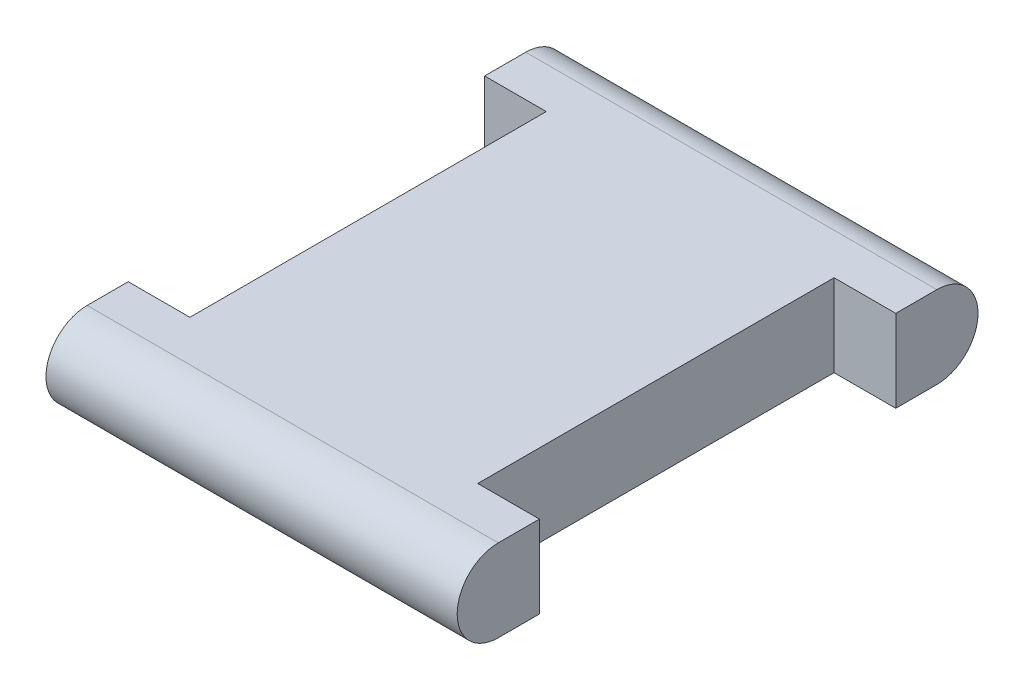
from build123d import *

# Parameters (mm, degrees)
AUFSATZ_LINEAR_AUSTRAGEN1_DEPTH = 75
SKIZZE5_OUTSIDE_W               = 200.786
SKIZZE5_OUTSIDE_H               = 240.786
SCHNITT_LINEAR_AUSTRAGEN5_DEPTH = 125.699639133


with BuildPart() as part:
    # Skizze1 → Aufsatz-Linear austragen1 (new, symmetric)
    with BuildSketch(Plane(origin=(0, 0, 0), x_dir=(0, 0, -1), z_dir=(1, 0, 0))):
        with BuildLine():
            Line((-80, -15), (80, -15))
            ThreePointArc((80, -15), (95, 0), (80, 15))
            Line((80, 15), (-80, 15))
            ThreePointArc((-80, 15), (-95, 0), (-80, -15))
        make_face()
    extrude(amount=AUFSATZ_LINEAR_AUSTRAGEN1_DEPTH, both=True)

    # Skizze5 outside → Schnitt-Linear austragen5 (cut, through all)
    with BuildSketch(Plane(origin=(0, 15, 0), x_dir=(1, 0, 0), z_dir=(0, 1, 0))):
        Rectangle(SKIZZE5_OUTSIDE_W, SKIZZE5_OUTSIDE_H)
        Polygon((75, 95), (-75, 95), (-75, 65), (-52.5, 65), (-52.5, -65), (-75, -65), (-75, -95), (75, -95), (75, -65), (52.5, -65), (52.5, 65), (75, 65), align=None, mode=Mode.SUBTRACT)
    extrude(amount=-SCHNITT_LINEAR_AUSTRAGEN5_DEPTH, mode=Mode.SUBTRACT)


solid = part.part
